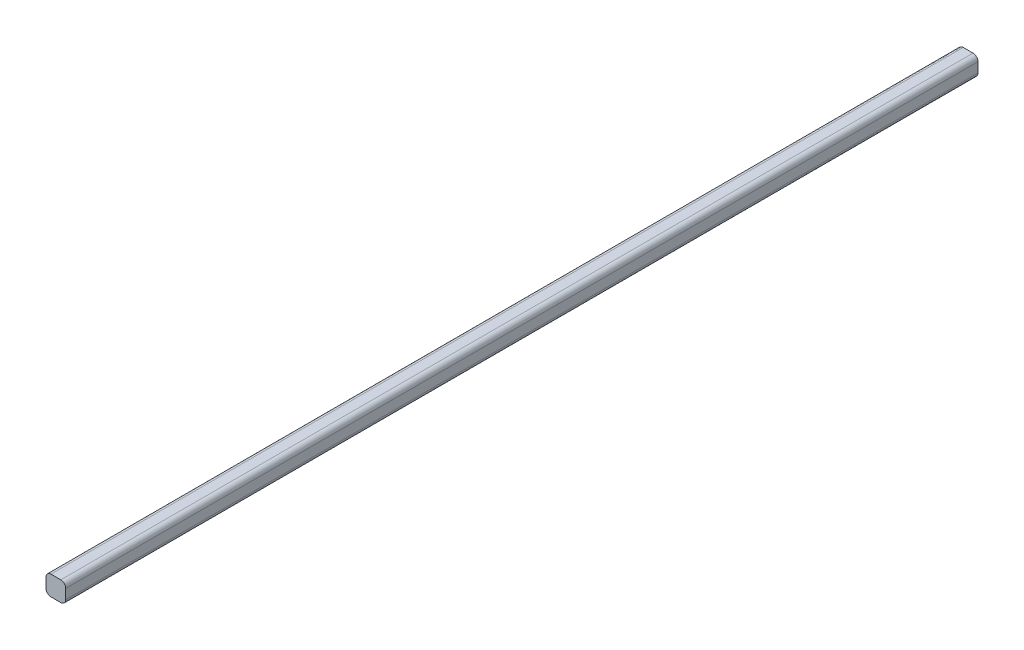
from build123d import *

# Parameters (mm, degrees)
ESQUISSE1_W        = 40
ESQUISSE1_H        = 40
BOSS_EXTRU_1_DEPTH = 1850
CONG_1_R           = 10


with BuildPart() as part:
    # Esquisse1 → Boss.-Extru.1 (new body)
    with BuildSketch(Plane.XY):
        with Locations((20, 20)):
            Rectangle(ESQUISSE1_W, ESQUISSE1_H)
    extrude(amount=BOSS_EXTRU_1_DEPTH)

    # Congé1
    cong_1_edges = [part.edges().sort_by_distance(p)[0] for p in [
        (0, 0, 925),
        (40, 0, 925),
        (0, 40, 925),
        (40, 40, 925),
    ]]
    fillet(cong_1_edges, radius=CONG_1_R)


solid = part.part
